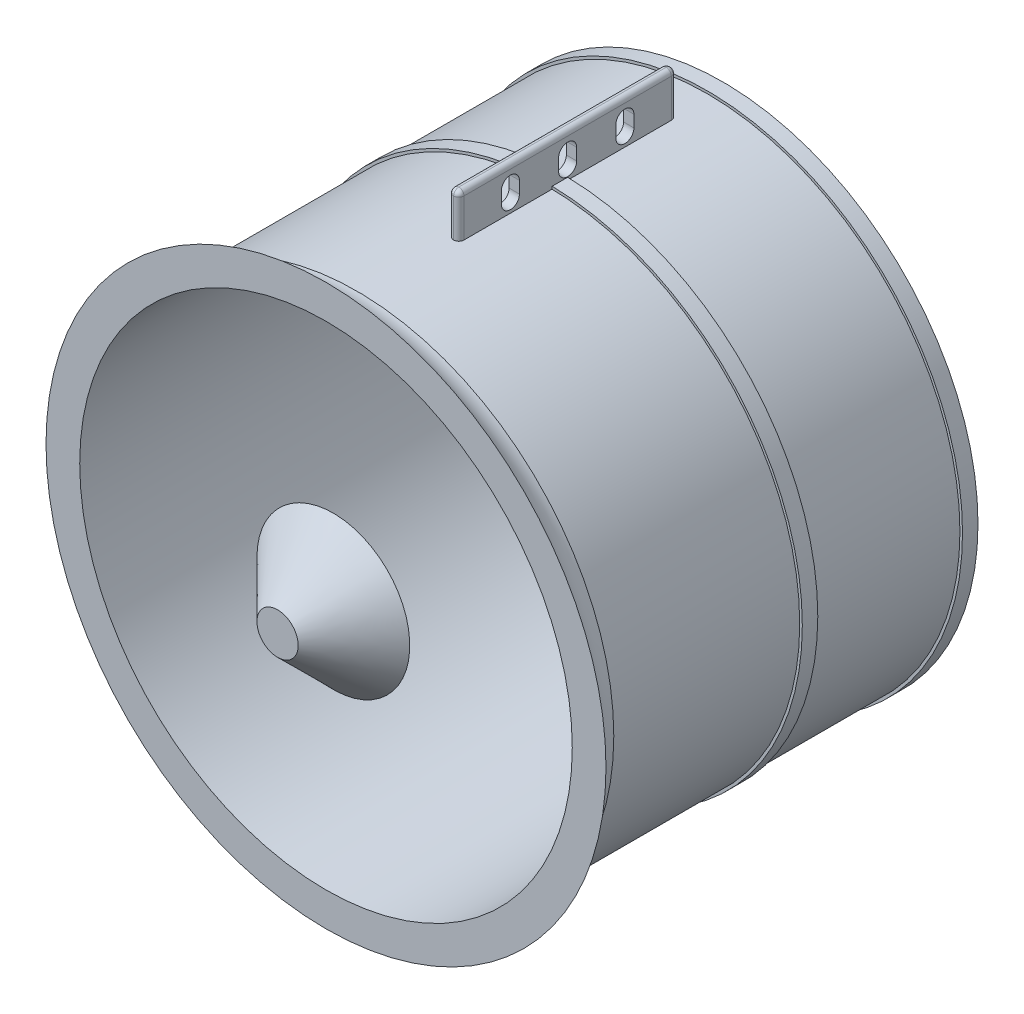
from build123d import *

# Parameters (mm, degrees)
BOSS_EXTRUDE3_DEPTH        = 1
BOSS_EXTRUDE3_DEPTH_BACK   = 1
SKETCH2_W                  = 42.2
SKETCH2_H                  = 8.4
BOSS_EXTRUDE3_2_DEPTH      = 1
BOSS_EXTRUDE3_2_DEPTH_BACK = 1
FILLET1_R                  = 1
FILLET2_R                  = 1


with BuildPart() as part:
    # Sketch1 → Revolve1 (revolve)
    with BuildSketch(Plane(origin=(0, 0, 0), x_dir=(0, 0, -1), z_dir=(1, 0, 0)), mode=Mode.PRIVATE) as revolve1_sk:
        with BuildLine():
            Line((72.485214156, 49.5), (72.485214156, 49))
            Line((72.485214156, 49), (44.425214156, 49))
            Line((44.425214156, 49), (44.425214156, 49.5))
            Line((44.425214156, 49.5), (41.425214156, 49.5))
            Line((41.425214156, 49.5), (41.425214156, 49))
            Line((41.425214156, 49), (4.575214156, 49))
            Line((4.575214156, 49), (4.575214156, 49.8))
            ThreePointArc((4.575214156, 49.8), (0.829493213, 51.045401555), (-1.424785844, 54.285721962))
            Line((-1.424785844, 54.285721962), (-1.424785844, 49))
            Line((-1.424785844, 49), (-1.424785844, 47.75))
            Line((-1.424785844, 47.75), (75.485214156, 47.75))
            Line((75.485214156, 47.75), (75.485214156, 49))
            Line((75.485214156, 49), (75.485214156, 49.5))
            Line((75.485214156, 49.5), (72.485214156, 49.5))
        make_face()
        Polygon((0, 0), (-10.814785844, 0), (-10.814785844, 4), (0, 14.814785844), align=None)
    revolve(revolve1_sk.sketch.rotate(Axis((0, 0, 9.162335512), (0, 0, -1)), 90), axis=Axis((0, 0, 9.162335512), (0, 0, -1)))


with BuildPart() as body_2:
    # Sketch2 → Boss-Extrude3 (new, two sides: drawn at the far end of the back side and taken through both)
    with BuildSketch(Plane(origin=(0, 0, 0), x_dir=(0, 0, -1), z_dir=(1, 0, 0)).offset(-BOSS_EXTRUDE3_DEPTH_BACK)):
        with Locations((44.425214156, 53.2)):
            Rectangle(SKETCH2_W, SKETCH2_H)
        with BuildLine():
            Line((57.275214156, 53.65), (57.275214156, 51.35))
            ThreePointArc((57.275214156, 51.35), (55.525214156, 49.6), (53.775214156, 51.35))
            Line((53.775214156, 51.35), (53.775214156, 53.65))
            ThreePointArc((53.775214156, 53.65), (55.525214156, 55.4), (57.275214156, 53.65))
        make_face(mode=Mode.SUBTRACT)
        with BuildLine():
            Line((42.675214156, 53.65), (42.675214156, 51.35))
            ThreePointArc((42.675214156, 51.35), (44.425214156, 49.6), (46.175214156, 51.35))
            Line((46.175214156, 51.35), (46.175214156, 53.65))
            ThreePointArc((46.175214156, 53.65), (44.425214156, 55.4), (42.675214156, 53.65))
        make_face(mode=Mode.SUBTRACT)
        with BuildLine():
            Line((31.575214156, 53.65), (31.575214156, 51.35))
            ThreePointArc((31.575214156, 51.35), (33.325214156, 49.6), (35.075214156, 51.35))
            Line((35.075214156, 51.35), (35.075214156, 53.65))
            ThreePointArc((35.075214156, 53.65), (33.325214156, 55.4), (31.575214156, 53.65))
        make_face(mode=Mode.SUBTRACT)
    extrude(amount=BOSS_EXTRUDE3_DEPTH + BOSS_EXTRUDE3_DEPTH_BACK)

    # Fillet1
    fillet1_edges = [body_2.edges().sort_by_distance(p)[0] for p in [
        (-1, 53.2, -65.525214156),
        (-1, 57.4, -44.425214156),
        (-1, 53.2, -23.325214156),
        (1, 53.2, -23.325214156),
        (1, 53.2, -65.525214156),
        (1, 57.4, -44.425214156),
        (0, 57.4, -23.325214156),
        (0, 57.4, -65.525214156),
    ]]
    fillet(fillet1_edges, radius=FILLET1_R - 0.0001)  # a hair under: the kernel refuses the full size


with BuildPart() as body_3:
    # Sketch2 → Boss-Extrude3 2 (new, two sides: drawn at the far end of the back side and taken through both)
    with BuildSketch(Plane(origin=(0, 0, 0), x_dir=(0, 0, -1), z_dir=(1, 0, 0)).offset(-BOSS_EXTRUDE3_2_DEPTH_BACK)):
        with Locations((44.425214156, -53.2)):
            Rectangle(SKETCH2_W, SKETCH2_H)
        with BuildLine():
            Line((57.275214156, -53.65), (57.275214156, -51.35))
            ThreePointArc((57.275214156, -51.35), (55.525214156, -49.6), (53.775214156, -51.35))
            Line((53.775214156, -51.35), (53.775214156, -53.65))
            ThreePointArc((53.775214156, -53.65), (55.525214156, -55.4), (57.275214156, -53.65))
        make_face(mode=Mode.SUBTRACT)
        with BuildLine():
            Line((46.175214156, -53.65), (46.175214156, -51.35))
            ThreePointArc((46.175214156, -51.35), (44.425214156, -49.6), (42.675214156, -51.35))
            Line((42.675214156, -51.35), (42.675214156, -53.65))
            ThreePointArc((42.675214156, -53.65), (44.425214156, -55.4), (46.175214156, -53.65))
        make_face(mode=Mode.SUBTRACT)
        with BuildLine():
            Line((35.075214156, -53.65), (35.075214156, -51.35))
            ThreePointArc((35.075214156, -51.35), (33.325214156, -49.6), (31.575214156, -51.35))
            Line((31.575214156, -51.35), (31.575214156, -53.65))
            ThreePointArc((31.575214156, -53.65), (33.325214156, -55.4), (35.075214156, -53.65))
        make_face(mode=Mode.SUBTRACT)
    extrude(amount=BOSS_EXTRUDE3_2_DEPTH + BOSS_EXTRUDE3_2_DEPTH_BACK)

    # Fillet2
    fillet2_edges = [body_3.edges().sort_by_distance(p)[0] for p in [
        (1, -53.2, -23.325214156),
        (1, -57.4, -44.425214156),
        (1, -53.2, -65.525214156),
        (-1, -53.2, -23.325214156),
        (-1, -57.4, -44.425214156),
        (-1, -53.2, -65.525214156),
        (0, -57.4, -23.325214156),
        (0, -57.4, -65.525214156),
    ]]
    fillet(fillet2_edges, radius=FILLET2_R - 0.0001)  # a hair under: the kernel refuses the full size


solid = Compound([part.part, body_2.part, body_3.part])
